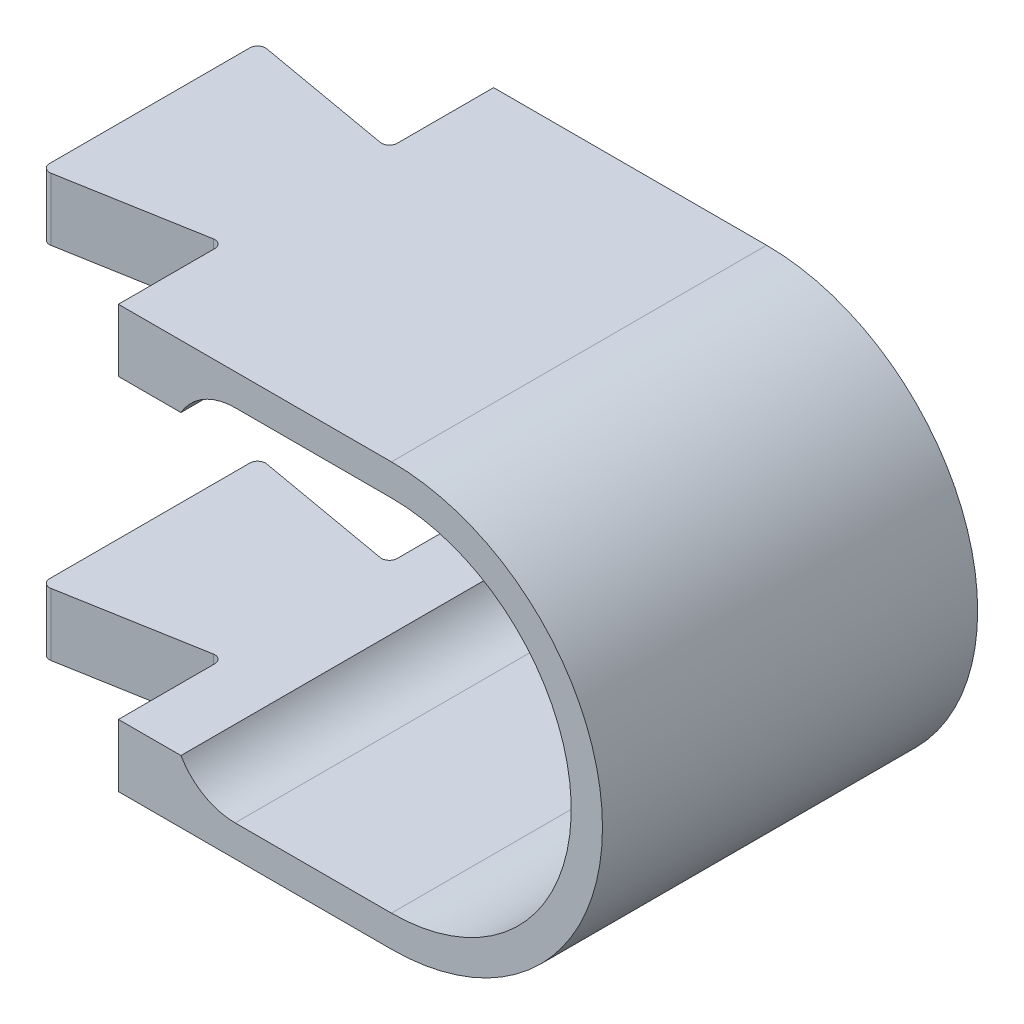
from build123d import *

# Parameters (mm, degrees)
BOSS_EXTRUDE1_DEPTH = 2
FILLET1_R           = 0.25
SKETCH3_W           = 26
SKETCH3_H           = 12
CUT_EXTRUDE2_DEPTH  = 1
FILLET6_R           = 2
SKETCH4_W           = 36.903708965
SKETCH4_H           = 12
CUT_EXTRUDE3_DEPTH  = 5
BOSS_EXTRUDE2_DEPTH = 6


with BuildPart() as part:
    # Sketch1 → Boss-Extrude1 (new body)
    with BuildSketch(Plane(origin=(0, 0, 0), x_dir=(1, 0, 0), z_dir=(0, 1, 0))):
        Polygon((-15, 2.618365096), (-20, 3.5), (-20, -3.5), (-15, -2.618365096), (-15, -6), (15, -6), (15, -2.618365096), (20, -3.5), (20, 3.5), (15, 2.618365096), (15, 6), (-15, 6), align=None)
    extrude(amount=BOSS_EXTRUDE1_DEPTH)

    # Fillet1
    fillet1_edges = [part.edges().sort_by_distance(p)[0] for p in [
        (15, 1, -2.618365096),
        (20, 1, -3.5),
        (20, 1, 3.5),
        (15, 1, 2.618365096),
        (-15, 1, 2.618365096),
        (-20, 1, 3.5),
        (-20, 1, -3.5),
        (-15, 1, -2.618365096),
    ]]
    fillet(fillet1_edges, radius=FILLET1_R)

    # Sketch3 → Cut-Extrude2 (cut)
    with BuildSketch(Plane(origin=(0, 2, 0), x_dir=(1, 0, 0), z_dir=(0, 1, 0))):
        Rectangle(SKETCH3_W, SKETCH3_H)
    extrude(amount=-CUT_EXTRUDE2_DEPTH, mode=Mode.SUBTRACT)

    # Fillet6
    # the kernel refuses this fillet: 2 mm, written as the material it adds along each edge
    with BuildSketch(Plane(origin=(-13, 1, 6), x_dir=(0, 1, 0), z_dir=(0, 0, -1))) as fillet6_piece_1:
        with BuildLine():
            CenterArc((2, 1.732050808), FILLET6_R, 180, 60)
            Line((0, 1.732050808), (-0.04, 1.732050808))
            Line((-0.04, 1.732050808), (-0.04, 0))
            Line((-0.04, 0), (0, -0.04))
            ThreePointArc((0, -0.04), (0.5, -0.04), (0.98, -0.034641016))
            Line((0.98, -0.034641016), (1, 0))
        make_face()
    extrude(amount=12)
    with BuildSketch(Plane(origin=(13, 1, -6), x_dir=(-1, 0, 0), z_dir=(0, 0, 1))) as fillet6_piece_2:
        with BuildLine():
            CenterArc((1.732050808, -2), FILLET6_R, 90, 60)
            Line((0, -1), (-0.034641016, -0.98))
            ThreePointArc((-0.034641016, -0.98), (-0.04, -0.5), (-0.04, 0))
            Line((-0.04, 0), (0, 0.04))
            Line((0, 0.04), (1.732050808, 0.04))
            Line((1.732050808, 0.04), (1.732050808, 0))
        make_face()
    extrude(amount=12)

    # Sketch4 → Cut-Extrude3 (cut, symmetric)
    with BuildSketch(Plane(origin=(0, 1, 0), x_dir=(1, 0, 0), z_dir=(0, 1, 0))):
        with Locations((7.18390529, 0)):
            Rectangle(SKETCH4_W, SKETCH4_H)
    extrude(amount=CUT_EXTRUDE3_DEPTH, both=True, mode=Mode.SUBTRACT)

    # Sketch6 → Boss-Extrude2 (add, symmetric)
    with BuildSketch(Plane.XY):
        with BuildLine():
            Line((-11.267949192, 0), (-11.267949192, 1))
            Line((-11.267949192, 1), (-6.267949192, 1))
            ThreePointArc((-6.267949192, 1), (-2.202085201, 2.684136008), (-0.517949192, 6.75))
            Line((-0.517949192, 6.75), (0.482050808, 6.75))
            ThreePointArc((0.482050808, 6.75), (-1.494978419, 1.977029227), (-6.267949192, 0))
            Line((-6.267949192, 0), (-11.267949192, 0))
        make_face()
    extrude(amount=BOSS_EXTRUDE2_DEPTH, both=True)

    # Mirror3: part across plane


with BuildPart() as part_1:
    add(part.part)
    add(part.part.mirror(Plane.ZX.offset(6.75)))


solid = part_1.part
